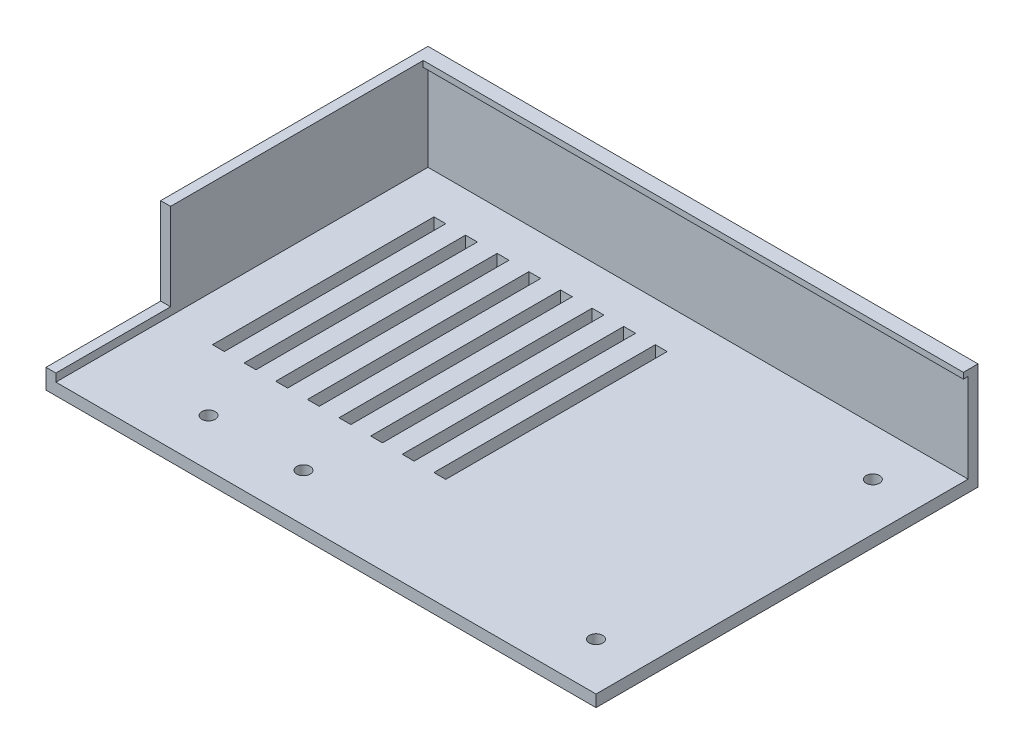
from build123d import *

# Parameters (mm, degrees)
SKETCH1_W                     = 278.2
SKETCH1_H                     = 193.2
SHELL_BLOCK_DEPTH             = 27
SKETCH2_W                     = 273.2
SKETCH2_H                     = 185.8
FRONT_OPENING_DEPTH           = 1.5
SKETCH3_W                     = 273.2
SKETCH3_H                     = 188.2
DISPLAY_POCKET_DEPTH          = 22.5
SKETCH4_W                     = 3
SKETCH4_H                     = 56
VENT_SLOTS_DEPTH              = 4
SKETCH5_W                     = 58
SKETCH5_H                     = 23
CABLE_EXIT_X_SHORT_SIDE_DEPTH = 140.1
SKETCH6_R                     = 1.7
BOLT_HOLES_DEPTH              = 4
KEEP_ONE_HALF_X_DEPTH         = 172.491603293
KEEP_ONE_HALF_X_DEPTH_BACK    = 172.491603293
SKETCH7_W                     = 200
SKETCH7_H                     = 400
KEEP_ONE_QUARTER_Z_DEPTH      = 172.491603293
KEEP_ONE_QUARTER_Z_DEPTH_BACK = 172.491603293
SKETCH8_W                     = 400
SKETCH8_H                     = 200


with BuildPart() as part:
    # Sketch1 → Shell Block (new body)
    with BuildSketch(Plane(origin=(0, 0, 0), x_dir=(1, 0, 0), z_dir=(0, 1, 0))):
        Rectangle(SKETCH1_W, SKETCH1_H)
    extrude(amount=SHELL_BLOCK_DEPTH)

    # Sketch2 → Front Opening (cut)
    with BuildSketch(Plane(origin=(0, 27, 0), x_dir=(1, 0, 0), z_dir=(0, 1, 0))):
        Rectangle(SKETCH2_W, SKETCH2_H)
    extrude(amount=-FRONT_OPENING_DEPTH, mode=Mode.SUBTRACT)

    # Sketch3 → Display Pocket (cut)
    with BuildSketch(Plane(origin=(0, 25.5, 0), x_dir=(1, 0, 0), z_dir=(0, 1, 0))):
        Rectangle(SKETCH3_W, SKETCH3_H)
    extrude(amount=-DISPLAY_POCKET_DEPTH, mode=Mode.SUBTRACT)

    # Sketch4 → Vent Slots (cut)
    with BuildSketch(Plane(origin=(0, 3, 0), x_dir=(1, 0, 0), z_dir=(0, 1, 0))):
        with Locations((-67.5, 56)):
            Rectangle(SKETCH4_W, SKETCH4_H)
        with Locations((-67.5, -56)):
            Rectangle(SKETCH4_W, SKETCH4_H)
        with Locations((-75.5, 56)):
            Rectangle(SKETCH4_W, SKETCH4_H)
        with Locations((-75.5, -56)):
            Rectangle(SKETCH4_W, SKETCH4_H)
        with Locations((-83.5, 56)):
            Rectangle(SKETCH4_W, SKETCH4_H)
        with Locations((-83.5, -56)):
            Rectangle(SKETCH4_W, SKETCH4_H)
        with Locations((-91.5, 56)):
            Rectangle(SKETCH4_W, SKETCH4_H)
        with Locations((-91.5, -56)):
            Rectangle(SKETCH4_W, SKETCH4_H)
        with Locations((-99.5, 56)):
            Rectangle(SKETCH4_W, SKETCH4_H)
        with Locations((-99.5, -56)):
            Rectangle(SKETCH4_W, SKETCH4_H)
        with Locations((-107.5, 56)):
            Rectangle(SKETCH4_W, SKETCH4_H)
        with Locations((-107.5, -56)):
            Rectangle(SKETCH4_W, SKETCH4_H)
        with Locations((-115.5, 56)):
            Rectangle(SKETCH4_W, SKETCH4_H)
        with Locations((-115.5, -56)):
            Rectangle(SKETCH4_W, SKETCH4_H)
        with Locations((-123.5, 56)):
            Rectangle(SKETCH4_W, SKETCH4_H)
        with Locations((-123.5, -56)):
            Rectangle(SKETCH4_W, SKETCH4_H)
    extrude(amount=-VENT_SLOTS_DEPTH, mode=Mode.SUBTRACT)

    # Sketch5 → Cable Exit (-X short side) (cut)
    with BuildSketch(Plane(origin=(0, 0, 0), x_dir=(0, 0, -1), z_dir=(1, 0, 0))):
        with Locations((0, 16.5)):
            Rectangle(SKETCH5_W, SKETCH5_H)
    extrude(amount=-CABLE_EXIT_X_SHORT_SIDE_DEPTH, mode=Mode.SUBTRACT)

    # Sketch6 → Bolt Holes (cut)
    with BuildSketch(Plane(origin=(0, 3, 0), x_dir=(1, 0, 0), z_dir=(0, 1, 0))):
        with Locations((-40, -29)):
            Circle(SKETCH6_R)
        with Locations((-40, -89)):
            Circle(SKETCH6_R)
        with Locations((40, -29)):
            Circle(SKETCH6_R)
        with Locations((40, -89)):
            Circle(SKETCH6_R)
        with Locations((-52, -47)):
            Circle(SKETCH6_R)
        with Locations((-52, -71)):
            Circle(SKETCH6_R)
        with Locations((52, -47)):
            Circle(SKETCH6_R)
        with Locations((52, -71)):
            Circle(SKETCH6_R)
        with Locations((-12, 82)):
            Circle(SKETCH6_R)
        with Locations((12, 82)):
            Circle(SKETCH6_R)
        with Locations((124, 12)):
            Circle(SKETCH6_R)
        with Locations((124, -12)):
            Circle(SKETCH6_R)
        with Locations((-12, 12)):
            Circle(SKETCH6_R)
        with Locations((-12, -12)):
            Circle(SKETCH6_R)
        with Locations((12, 12)):
            Circle(SKETCH6_R)
        with Locations((12, -12)):
            Circle(SKETCH6_R)
        with Locations((-110, -12)):
            Circle(SKETCH6_R)
        with Locations((-110, 12)):
            Circle(SKETCH6_R)
        with Locations((-86, -12)):
            Circle(SKETCH6_R)
        with Locations((-86, 12)):
            Circle(SKETCH6_R)
    extrude(amount=-BOLT_HOLES_DEPTH, mode=Mode.SUBTRACT)

    # Sketch7 → Keep one half (X) (cut, two sides: drawn at the far end of the back side and taken through both)
    with BuildSketch(Plane(origin=(0, 0, 0), x_dir=(1, 0, 0), z_dir=(0, 1, 0)).offset(-KEEP_ONE_HALF_X_DEPTH_BACK)):
        with Locations((100, 0)):
            Rectangle(SKETCH7_W, SKETCH7_H)
    extrude(amount=KEEP_ONE_HALF_X_DEPTH + KEEP_ONE_HALF_X_DEPTH_BACK, mode=Mode.SUBTRACT)

    # Sketch8 → Keep one quarter (Z) (cut, two sides: drawn at the far end of the back side and taken through both)
    with BuildSketch(Plane(origin=(0, 0, 0), x_dir=(1, 0, 0), z_dir=(0, 1, 0)).offset(-KEEP_ONE_QUARTER_Z_DEPTH_BACK)):
        with Locations((0, -100)):
            Rectangle(SKETCH8_W, SKETCH8_H)
    extrude(amount=KEEP_ONE_QUARTER_Z_DEPTH + KEEP_ONE_QUARTER_Z_DEPTH_BACK, mode=Mode.SUBTRACT)


solid = part.part
